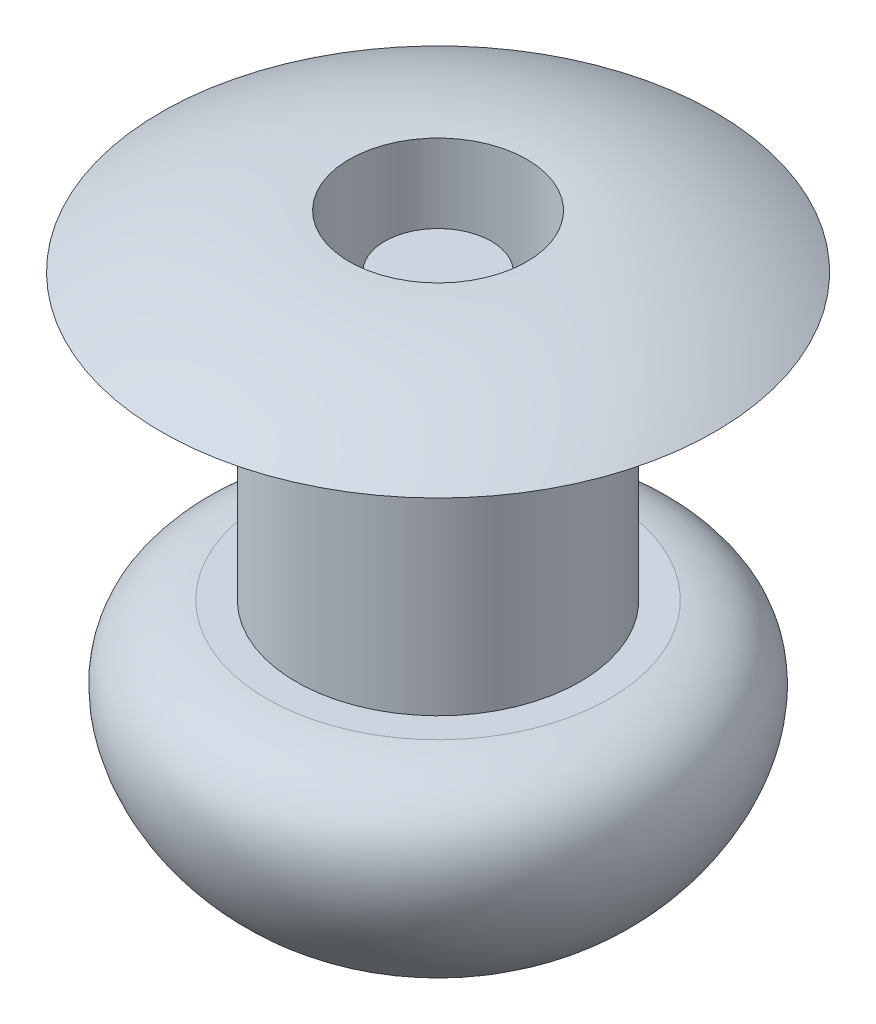
from build123d import *


with BuildPart() as part:
    # Szkic1 → Obrót1 (revolve)
    with BuildSketch(Plane(origin=(0, 0, 0), x_dir=(0, 0, -1), z_dir=(1, 0, 0))):
        with BuildLine():
            Line((0, 0), (0, -4))
            Line((0, -4), (0, -5.5))
            add(Edge.make_bspline(
                [(-0.956030427, -5.378190671), (-0.520263876, -5.5), (0, -5.5)],
                knots=[0.992852221, 0.992852221, 0.992852221, 1.570796327, 1.570796327, 1.570796327], degree=2, weights=[1, 0.958537313, 1]))
            add(Edge.make_bspline(
                [(-2.413891755, -4), (-3.858559437, -4.163296686), (-3.558358928, -6.322980362), (-0.971318098, -7.871940016), (-0.341145137, -5.79203191), (-0.956030427, -5.378190671)],
                knots=[0, 0, 0, 0, 0.454219308, 0.705200672, 1, 1, 1, 1], degree=3))
            Line((-2.413891755, -4), (-2, -4))
            Line((-2, -4), (-2, 0))
            Line((-2, 0), (-3.9, 0))
            ThreePointArc((-3.9, 0), (-2.627043935, 0.558888572), (-1.25, 0.75))
            Line((-1.25, 0.75), (-1.25, -4))
            Line((-1.25, -4), (-0.75, -4))
            Line((-0.75, -4), (-0.75, 0))
            Line((-0.75, 0), (0, 0))
        make_face()
    revolve(axis=Axis((0, 0, 0), (0, 1, 0)))


solid = part.part
